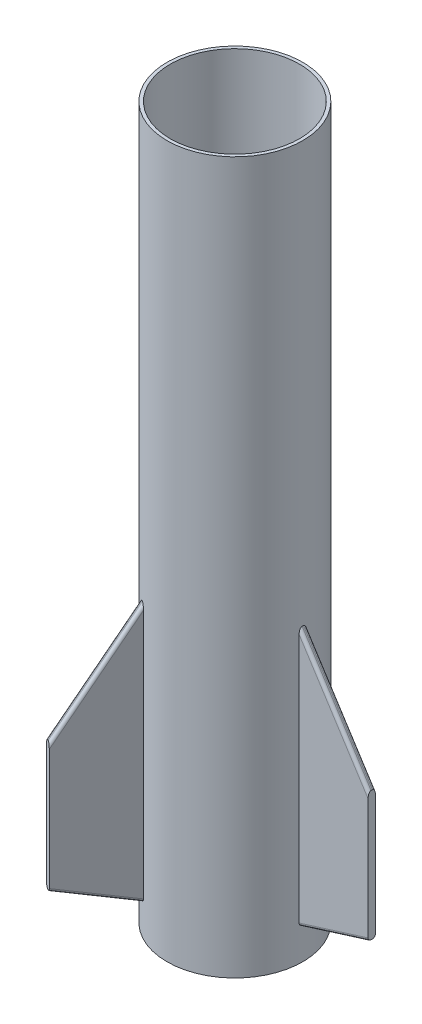
from build123d import *

# Parameters (mm, degrees)
SKETCH3_R                = 40.005
SKETCH3_R_2              = 38.1
BOSS_EXTRUDE1_DEPTH      = 419.1
BOSS_EXTRUDE2_DEPTH      = 2.159
BOSS_EXTRUDE2_DEPTH_BACK = 2.159
FILLET1_R                = 1.778
CIRPATTERN1_COUNT        = 3


with BuildPart() as part:
    # Sketch3 → Boss-Extrude1 (new body)
    with BuildSketch(Plane(origin=(0, 0, 0), x_dir=(1, 0, 0), z_dir=(0, 1, 0))):
        Circle(SKETCH3_R)
        Circle(SKETCH3_R_2, mode=Mode.SUBTRACT)
    extrude(amount=BOSS_EXTRUDE1_DEPTH)


with BuildPart() as body_2:
    # Sketch4 → Boss-Extrude2 (new, two sides: drawn at the far end of the back side and taken through both)
    with BuildSketch(Plane.XY.offset(-BOSS_EXTRUDE2_DEPTH_BACK)):
        Polygon((40.005, 19.05), (40.005, 171.45), (80.645, 107.95), (80.645, 31.75), align=None)
    extrude(amount=BOSS_EXTRUDE2_DEPTH + BOSS_EXTRUDE2_DEPTH_BACK)

    # Fillet1
    fillet1_edges = [body_2.edges().sort_by_distance(p)[0] for p in [
        (60.325, 25.4, 2.159),
        (60.325, 25.4, -2.159),
        (60.325, 139.7, 2.159),
        (60.325, 139.7, -2.159),
    ]]
    fillet(fillet1_edges, radius=FILLET1_R)


with BuildPart() as cirpattern1_1:
    # CirPattern1: pattern copy
    add(body_2.part.rotate(Axis((0, 0, 0), (0, 1, 0)), 1 * 360 / CIRPATTERN1_COUNT))


with BuildPart() as cirpattern1_2:
    # CirPattern1: pattern copy
    add(body_2.part.rotate(Axis((0, 0, 0), (0, 1, 0)), 2 * 360 / CIRPATTERN1_COUNT))


solid = Compound([part.part, body_2.part, cirpattern1_1.part, cirpattern1_2.part])
